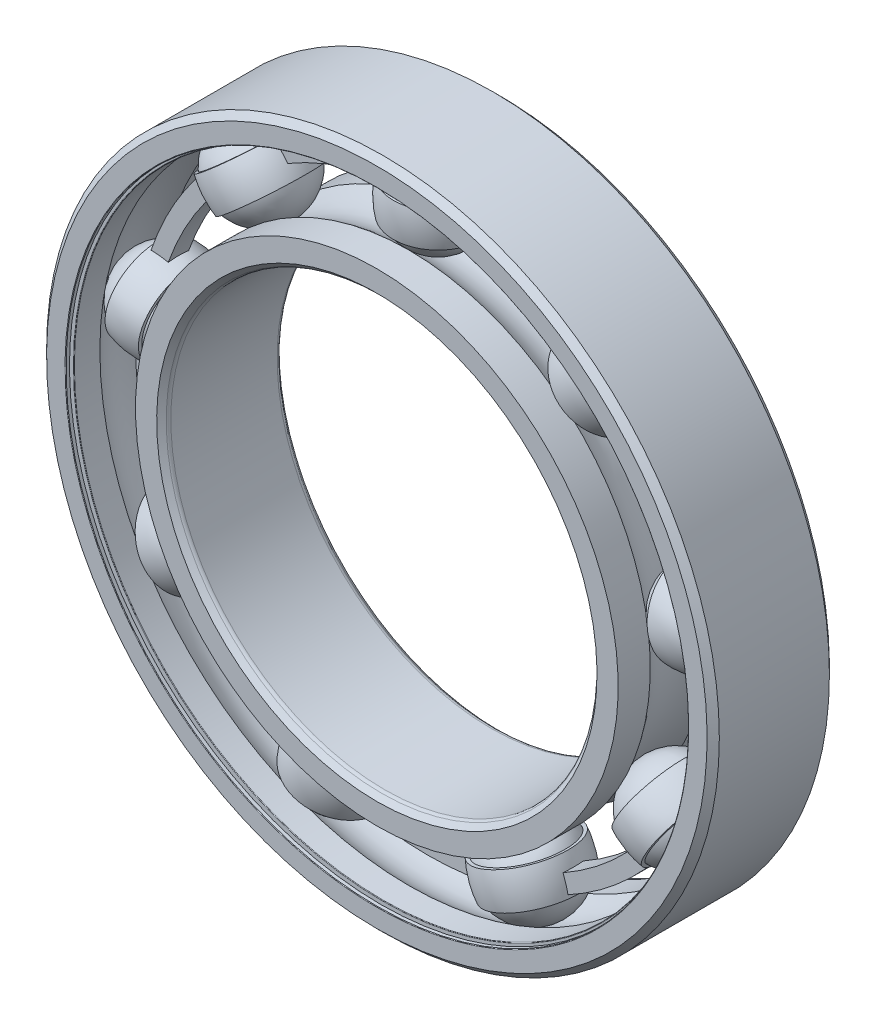
from build123d import *

# Parameters (mm, degrees)
BOSS_EXTRUDE1_DEPTH = 0.833333333
CIRPATTERN1_COUNT   = 9
CIRPATTERN2_COUNT   = 9
FILLET1_R           = 0.045
FILLET2_R           = 0.375


with BuildPart() as part:
    # Sketch3 → Revolve1 (revolve)
    with BuildSketch(Plane(origin=(0, 0, 0), x_dir=(0, 0, -1), z_dir=(1, 0, 0))):
        with BuildLine():
            Line((4.5, 27.5), (5, 27))
            Line((5, 27), (5, 25.268980769))
            Line((5, 25.268980769), (2.375, 25.268980769))
            ThreePointArc((2.375, 25.268980769), (0, 26.147936406), (-2.375, 25.268980769))
            Line((-2.375, 25.268980769), (-5, 25.268980769))
            Line((-5, 25.268980769), (-5, 27))
            Line((-5, 27), (-4.5, 27.5))
            Line((-4.5, 27.5), (4.5, 27.5))
        make_face()
    revolve(axis=Axis((0, 0, 5), (0, 0, -1)))

    # Sketch8 → Cut-Revolve1 (revolve, cut)
    with BuildSketch(Plane(origin=(0, 0, 0), x_dir=(0, 0, -1), z_dir=(1, 0, 0))):
        Polygon((-4.68, 25.268980769), (-4.5, 25.268980769), (-4.5, 26.012653846), (-4.68, 26.012653846), (-4.68, 25.448980769), (-5, 25.448980769), (-5, 25.268980769), align=None)
        Polygon((4.5, 25.268980769), (4.68, 25.268980769), (5, 25.268980769), (5, 25.448980769), (4.68, 25.448980769), (4.68, 26.012653846), (4.5, 26.012653846), align=None)
    revolve(axis=Axis((0, 0, 5), (0, 0, -1)), mode=Mode.SUBTRACT)

    # Fillet1
    fillet1_edges = [part.edges().sort_by_distance(p)[0] for p in [
        (0, -25.268980769, -4.5),
        (0, -25.448980769, -5),
        (0, -25.268980769, 4.5),
        (0, -25.448980769, 5),
    ]]
    fillet(fillet1_edges, radius=FILLET1_R)


with BuildPart() as body_2:
    # Sketch4 → Revolve2 (revolve)
    with BuildSketch(Plane(origin=(0, 0, 0), x_dir=(0, 0, -1), z_dir=(1, 0, 0))):
        with BuildLine():
            Line((-4.5, 17.4995), (-5, 17.9995))
            Line((-5, 17.9995), (-5, 19.730519231))
            Line((-5, 19.730519231), (-2.375, 19.730519231))
            ThreePointArc((-2.375, 19.730519231), (0, 18.851563594), (2.375, 19.730519231))
            Line((2.375, 19.730519231), (5, 19.730519231))
            Line((5, 19.730519231), (5, 17.9995))
            Line((5, 17.9995), (4.5, 17.4995))
            Line((4.5, 17.4995), (-4.5, 17.4995))
        make_face()
    revolve(axis=Axis((0, 0, 5), (0, 0, -1)))

    # Fillet2
    fillet2_edges = [body_2.edges().sort_by_distance(p)[0] for p in [
        (0, -17.4995, -4.5),
        (0, -17.4995, 4.5),
    ]]
    fillet(fillet2_edges, radius=FILLET2_R)


with BuildPart() as body_3:
    # Sketch5 → Revolve3 (revolve)
    with BuildSketch(Plane(origin=(0, 0, 0), x_dir=(0, 0, -1), z_dir=(1, 0, 0))):
        with BuildLine():
            Line((-3.648186406, 22.49975), (3.648186406, 22.49975))
            ThreePointArc((3.648186406, 22.49975), (0, 26.147936406), (-3.648186406, 22.49975))
        make_face()
    revolve(axis=Axis((0, 22.49975, 3.648186406), (0, 0, -1)))


with BuildPart() as body_4:
    # Sketch6 → Revolve4 (revolve)
    with BuildSketch(Plane(origin=(0, 0, 0), x_dir=(0, 0, -1), z_dir=(1, 0, 0))):
        with BuildLine():
            Line((-3.375219147, 23.884365385), (-3.646015956, 23.884365385))
            ThreePointArc((-3.646015956, 23.884365385), (-3.78141436, 22.49975), (-3.646015956, 21.115134615))
            Line((-3.646015956, 21.115134615), (-3.375219147, 21.115134615))
            ThreePointArc((-3.375219147, 21.115134615), (-3.648186406, 22.49975), (-3.375219147, 23.884365385))
        make_face()
    revolve4 = revolve(axis=Axis((0, 27.5, 0), (0, -1, 0)))

    # Sketch7 → Boss-Extrude1 (add, symmetric)
    with BuildSketch(Plane.XY):
        with BuildLine():
            Line((14.462560521, 17.235808459), (15.352574134, 18.29648538))
            ThreePointArc((15.352574134, 18.29648538), (8.168934072, 22.443961904), (0, 23.884365385))
            Line((0, 23.884365385), (0, 22.49975))
            ThreePointArc((0, 22.49975), (7.69536772, 21.142849045), (14.462560521, 17.235808459))
        make_face()
    boss_extrude1 = extrude(amount=BOSS_EXTRUDE1_DEPTH, both=True)

    # CirPattern2: Revolve4, Boss-Extrude1 ×9 about axis
    cirpattern2_axis = Axis((0, 0, 5), (0, 0, -1))
    add([revolve4.rotate(cirpattern2_axis, i * 360 / CIRPATTERN2_COUNT) for i in range(1, CIRPATTERN2_COUNT)])
    add([boss_extrude1.rotate(cirpattern2_axis, i * 360 / CIRPATTERN2_COUNT) for i in range(1, CIRPATTERN2_COUNT)])


with BuildPart() as cirpattern1_1:
    # CirPattern1: pattern copy
    add(body_3.part.rotate(Axis((0, 0, 5), (0, 0, -1)), 1 * 360 / CIRPATTERN1_COUNT))


with BuildPart() as cirpattern1_2:
    # CirPattern1: pattern copy
    add(body_3.part.rotate(Axis((0, 0, 5), (0, 0, -1)), 2 * 360 / CIRPATTERN1_COUNT))


with BuildPart() as cirpattern1_3:
    # CirPattern1: pattern copy
    add(body_3.part.rotate(Axis((0, 0, 5), (0, 0, -1)), 3 * 360 / CIRPATTERN1_COUNT))


with BuildPart() as cirpattern1_4:
    # CirPattern1: pattern copy
    add(body_3.part.rotate(Axis((0, 0, 5), (0, 0, -1)), 4 * 360 / CIRPATTERN1_COUNT))


with BuildPart() as cirpattern1_5:
    # CirPattern1: pattern copy
    add(body_3.part.rotate(Axis((0, 0, 5), (0, 0, -1)), 5 * 360 / CIRPATTERN1_COUNT))


with BuildPart() as cirpattern1_6:
    # CirPattern1: pattern copy
    add(body_3.part.rotate(Axis((0, 0, 5), (0, 0, -1)), 6 * 360 / CIRPATTERN1_COUNT))


with BuildPart() as cirpattern1_7:
    # CirPattern1: pattern copy
    add(body_3.part.rotate(Axis((0, 0, 5), (0, 0, -1)), 7 * 360 / CIRPATTERN1_COUNT))


with BuildPart() as cirpattern1_8:
    # CirPattern1: pattern copy
    add(body_3.part.rotate(Axis((0, 0, 5), (0, 0, -1)), 8 * 360 / CIRPATTERN1_COUNT))


solid = Compound([part.part, body_2.part, body_3.part, body_4.part, cirpattern1_1.part, cirpattern1_2.part, cirpattern1_3.part, cirpattern1_4.part, cirpattern1_5.part, cirpattern1_6.part, cirpattern1_7.part, cirpattern1_8.part])
